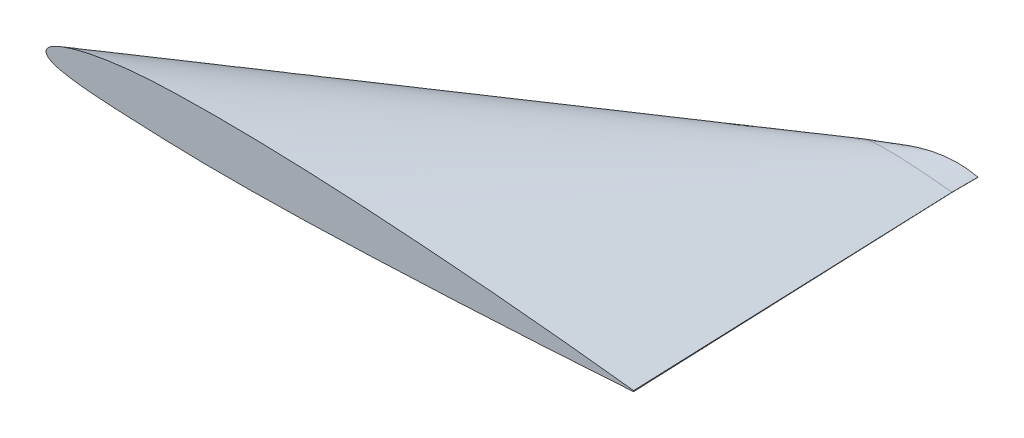
from build123d import *

# Parameters (mm, degrees)
ENL_V_MAT_EXTRU_1_DEPTH      = 6537.595381791
ENL_V_MAT_EXTRU_1_DEPTH_BACK = 6537.595381791
ESQUISSE15_W                 = 150
ESQUISSE15_H                 = 60
ENL_V_MAT_EXTRU_2_DEPTH      = 200


with BuildPart() as part:
    # Esquisse4 → Lissage2 section 0
    with BuildSketch(Plane.XY.offset(3692)):
        with BuildLine():
            Line((1163.137487, 5.49948), (1162.862513, -5.49948))
            add(Edge.make_bspline(
                [(1163.137487, 5.49948), (1159.78106179, 5.89669381), (1146.377392091, 7.482941789), (1116.297833912, 11.039513369), (1066.368733676, 16.900425245), (996.895597623, 24.963474912), (908.298083843, 35.080484665), (801.118937573, 47.101459337), (676.01009383, 60.834401529), (533.736979055, 76.062927652), (375.167522141, 92.556247028), (201.273798033, 110.089901214), (13.120890751, 128.423622932), (-188.135699779, 147.297255115), (-401.262664582, 166.464478241), (-624.949204201, 185.691297569), (-857.822130249, 204.706218302), (-1098.446242625, 223.266314764), (-1345.341449909, 241.09149941), (-1596.987428004, 257.939858027), (-1851.831449746, 273.536215856), (-2108.299983915, 287.619425525), (-2364.80991271, 299.911578585), (-2619.776181926, 310.18463934), (-2871.622338494, 318.185814838), (-3118.78806458, 323.714366097), (-3359.742111465, 326.581871654), (-3592.994296128, 326.655535892), (-3817.096397659, 323.806053153), (-4031.614130657, 318.112548808), (-4235.351320938, 309.000952609), (-4426.727146878, 293.845099443), (-4603.43565084, 274.03248396), (-4764.100368398, 250.194189162), (-4907.721668542, 223.181517449), (-5033.437384748, 193.803106045), (-5140.556678001, 162.863012439), (-5228.523026224, 131.09581304), (-5297.199939068, 99.233565666), (-5346.367811477, 67.467297955), (-5377.758957488, 35.828703944), (-5388.176056434, -0.41686513), (-5370.844102186, -33.827420078), (-5334.216990612, -58.759198867), (-5280.568860654, -80.740993568), (-5208.422300925, -99.867381814), (-5118.127051242, -116.596136827), (-5010.026464029, -130.988054128), (-4884.808251899, -143.303271984), (-4743.228742952, -153.870532207), (-4586.150463994, -163.016678971), (-4414.506740871, -171.237292035), (-4229.054003313, -178.837304984), (-4029.818915697, -187.031891328), (-3817.732690903, -193.143429014), (-3594.196495685, -196.730525783), (-3361.529942842, -197.986403644), (-3121.158890336, -197.033393791), (-2874.556017894, -194.039497573), (-2623.237342525, -189.218487827), (-2368.743030101, -182.789690913), (-2112.635050915, -174.98330921), (-1856.48667863, -166.02267363), (-1601.874693554, -156.146513558), (-1350.368962495, -145.542159056), (-1103.517808322, -134.431069727), (-862.84485688, -122.988356567), (-629.831484637, -111.388460878), (-405.920857852, -99.774144504), (-192.495844993, -88.302550494), (9.120441117, -77.098622961), (197.679630167, -66.292203212), (372.014797091, -56.02009427), (531.042213688, -46.387339906), (673.779461703, -37.541439679), (799.33410695, -29.569386976), (906.926140198, -22.603093993), (995.886416419, -16.756848485), (1065.658093761, -12.084283131), (1115.810295543, -8.708032179), (1146.025671734, -6.643152475), (1159.490800158, -5.728509609), (1162.862513, -5.49948)],
                knots=[0, 0, 0, 0, 0.000766498, 0.00306096, 0.006869104, 0.0121674, 0.018922159, 0.027092231, 0.03662638, 0.047465327, 0.059541866, 0.072781463, 0.087101665, 0.102414081, 0.118623542, 0.135630561, 0.153329686, 0.171611168, 0.190362332, 0.209467255, 0.228808125, 0.248264858, 0.267717609, 0.287046909, 0.306133614, 0.324860534, 0.343113432, 0.360781084, 0.37775727, 0.393938802, 0.409446397, 0.424002015, 0.437467007, 0.449764836, 0.460828766, 0.470599898, 0.479033183, 0.486099467, 0.49179537, 0.496160143, 0.499334803, 0.501730265, 0.504125152, 0.507288922, 0.511617008, 0.51723797, 0.524181213, 0.53243427, 0.541961526, 0.552712589, 0.564629489, 0.577643893, 0.591682903, 0.606722644, 0.622865238, 0.639799245, 0.657422637, 0.675630373, 0.694311464, 0.713351997, 0.732635699, 0.752045003, 0.771460131, 0.790761615, 0.809830421, 0.828548383, 0.84680031, 0.864472982, 0.881457663, 0.89764806, 0.912944362, 0.927251684, 0.940480559, 0.952549474, 0.963382766, 0.972913283, 0.981080683, 0.987834087, 0.993131631, 0.996939277, 0.999233585, 1, 1, 1, 1], degree=3))
        make_face()
    # Esquisse1 → Lissage2 section 1
    with BuildSketch(Plane.XY):
        with BuildLine():
            Line((1018.021378, 0.85512), (1017.978622, -0.85512))
            add(Edge.make_bspline(
                [(1018.021378, 0.85512), (1015.937227129, 1.101767387), (1011.26018293, 1.65527646), (1002.974701525, 2.627865114), (992.172249638, 3.88159729), (978.396127899, 5.454701908), (961.730728341, 7.323856057), (942.277421035, 9.459205859), (920.155222954, 11.827105598), (895.499089284, 14.391669387), (868.460168993, 17.117995942), (839.20407313, 19.968725851), (807.910471609, 22.903407012), (774.771132955, 25.883738941), (739.989874771, 28.873337548), (703.780215581, 31.829987816), (666.365316177, 34.715916974), (627.975317549, 37.487573912), (588.84661651, 40.10734313), (549.22064826, 42.532437413), (509.342082843, 44.722250677), (469.457080932, 46.633570643), (429.812104292, 48.230939797), (390.652277289, 49.475051093), (352.220215405, 50.334691414), (314.754014133, 50.780562906), (278.485383617, 50.792017037), (243.639509269, 50.348947932), (210.283918587, 49.46365888), (178.60460597, 48.046887087), (148.847375054, 45.690287343), (121.370781647, 42.609602669), (96.388853669, 38.902960832), (74.057024809, 34.702731749), (54.509354258, 30.134651284), (37.85326131, 25.32374319), (24.175280175, 20.384227535), (13.496633883, 15.42993277), (5.851469057, 10.490561985), (0.970426344, 5.57104332), (-0.649339461, -0.064818803), (2.045624557, -5.259861561), (7.740813129, -9.136530388), (16.082617971, -12.554503048), (27.300763351, -15.528485518), (41.340867853, -18.129657445), (58.149543244, -20.367471988), (77.619856357, -22.282378323), (99.63420493, -23.925492865), (124.058473752, -25.347636962), (150.747538994, -26.625868839), (179.583782592, -27.807602944), (210.563058473, -29.081787899), (243.540571355, -30.0320774), (278.298452328, -30.589838895), (314.476022329, -30.785116681), (351.851573184, -30.636932164), (390.196116356, -30.171408054), (429.273924746, -29.421784116), (468.845516322, -28.42216364), (508.66801866, -27.208341038), (548.496801765, -25.815042272), (588.086690387, -24.279387628), (627.193584265, -22.630505257), (665.576733027, -20.902830148), (702.99922647, -19.123590497), (739.230723788, -17.319910367), (774.046825524, -15.51398795), (807.232507988, -13.730257584), (838.582038958, -11.988146964), (867.901308005, -10.307845253), (895.008868709, -8.710624098), (919.736211018, -7.212816866), (941.930577671, -5.837358423), (961.453203127, -4.597775461), (978.182802921, -3.514579148), (992.015330978, -2.60554021), (1002.864203368, -1.878998049), (1010.662422615, -1.354021194), (1015.360643627, -1.032950851), (1017.454350781, -0.890732058), (1017.978622, -0.85512)],
                knots=[0, 0, 0, 0, 0.00306096, 0.006869104, 0.0121674, 0.018922159, 0.027092231, 0.03662638, 0.047465327, 0.059541866, 0.072781463, 0.087101665, 0.102414081, 0.118623542, 0.135630561, 0.153329686, 0.171611168, 0.190362332, 0.209467255, 0.228808125, 0.248264858, 0.267717609, 0.287046909, 0.306133614, 0.324860534, 0.343113432, 0.360781084, 0.37775727, 0.393938802, 0.409446397, 0.424002015, 0.437467007, 0.449764836, 0.460828766, 0.470599898, 0.479033183, 0.486099467, 0.49179537, 0.496160143, 0.499334803, 0.501730265, 0.504125152, 0.507288922, 0.511617008, 0.51723797, 0.524181213, 0.53243427, 0.541961526, 0.552712589, 0.564629489, 0.577643893, 0.591682903, 0.606722644, 0.622865238, 0.639799245, 0.657422637, 0.675630373, 0.694311464, 0.713351997, 0.732635699, 0.752045003, 0.771460131, 0.790761615, 0.809830421, 0.828548383, 0.84680031, 0.864472982, 0.881457663, 0.89764806, 0.912944362, 0.927251684, 0.940480559, 0.952549474, 0.963382766, 0.972913283, 0.981080683, 0.987834087, 0.993131631, 0.996939277, 0.999233585, 1, 1, 1, 1], degree=3))
        make_face()
    loft()

    # Esquisse11 → Lissage11 section 0
    with BuildSketch(Plane.XY.offset(-291)):
        with BuildLine():
            Line((1017.010689, 0.85512), (1016.989311, -0.85512))
            add(Edge.make_bspline(
                [(1017.010689, 0.85512), (1015.968662516, 1.101755795), (1013.630604319, 1.655155375), (1009.488376074, 2.627625328), (1004.087955119, 3.881175314), (997.200571264, 5.454133958), (988.868759257, 7.323101594), (979.143076644, 9.458258196), (968.082904989, 11.825987549), (955.755578331, 14.390432807), (942.236879706, 17.116647531), (927.60963915, 19.967270956), (911.963435532, 22.90190022), (895.394216264, 25.882216485), (878.004207088, 28.871782656), (859.899786119, 31.828449595), (841.192852995, 34.714392931), (821.998087264, 37.486121268), (802.43401032, 40.105969512), (782.621088579, 42.531185388), (762.68167066, 44.721156427), (742.73854362, 46.632688106), (722.915091383, 48.230290079), (703.333553865, 49.474654577), (684.115222533, 50.334527338), (665.37897119, 50.780552268), (647.2405725, 50.792033121), (629.812454434, 50.348649042), (613.125313637, 49.462805576), (597.256447413, 48.041695396), (582.357488419, 45.67795846), (568.599500226, 42.587731484), (556.089600456, 38.868339915), (544.904056721, 34.651084403), (535.107470588, 30.059595707), (526.752993856, 25.212719858), (519.87733351, 20.219896154), (514.506176065, 15.16615512), (510.655834279, 10.107638519), (508.356833584, 5.052560994), (507.720487238, 0.068104938), (508.770552543, -4.653362254), (511.538202456, -8.83906199), (515.815554065, -12.407683731), (521.504991894, -15.471089386), (528.583485385, -18.102795627), (537.021858751, -20.356284072), (546.778531224, -22.277136393), (557.798267312, -23.923143079), (570.018536684, -25.346540086), (583.367795314, -26.625366601), (597.790019797, -27.807435203), (613.272321516, -29.081108562), (629.763200366, -30.031796186), (647.146154658, -30.589790593), (665.237821585, -30.785126651), (683.927663124, -30.636907135), (703.101273778, -30.171309222), (722.640954757, -29.421606767), (742.42709724, -28.421921021), (762.338401497, -27.20805222), (782.252597675, -25.814731594), (802.047341545, -24.279063112), (821.600405021, -22.630189366), (840.791675672, -20.902523291), (859.502615479, -19.123297913), (877.618152719, -17.319626376), (895.025938853, -15.513720922), (911.61863058, -13.729997746), (927.293218871, -11.987898489), (941.95263131, -10.307615454), (955.50628793, -8.710402418), (967.869637035, -7.212629137), (978.966716865, -5.837179229), (988.727675541, -4.597637376), (997.092161926, -3.514480077), (1004.00834299, -2.605450065), (1009.432347315, -1.878965098), (1013.331456705, -1.353987833), (1015.680289844, -1.032955193), (1016.727173594, -0.890732302), (1016.989311, -0.85512)],
                knots=[0, 0, 0, 0, 0.003056441, 0.006857926, 0.012144646, 0.0188807, 0.027022764, 0.036517114, 0.047301785, 0.059307024, 0.072456183, 0.086664852, 0.101842805, 0.117893617, 0.134717022, 0.152206846, 0.170253151, 0.188743266, 0.207561961, 0.226592427, 0.245716214, 0.264815804, 0.283775153, 0.302479486, 0.320817322, 0.33868149, 0.355969352, 0.372584786, 0.388436261, 0.403662019, 0.418037642, 0.431460549, 0.443882367, 0.455258974, 0.465550233, 0.474729126, 0.482787477, 0.489753082, 0.495707884, 0.500826465, 0.505424548, 0.509802757, 0.514334163, 0.519482974, 0.525550406, 0.532696692, 0.540992813, 0.550454929, 0.561065643, 0.572787818, 0.585567358, 0.599341163, 0.614091303, 0.629906599, 0.646483338, 0.663728724, 0.68154543, 0.699828842, 0.71847016, 0.737357156, 0.756375443, 0.775407788, 0.794336727, 0.813045038, 0.831415991, 0.849335791, 0.866692541, 0.883378819, 0.899289507, 0.914325965, 0.928394307, 0.941405881, 0.953279903, 0.963941076, 0.973322701, 0.981364397, 0.988015229, 0.993233377, 0.996984422, 0.999244906, 1, 1, 1, 1], degree=3))
        make_face()
    # Esquisse10 → Lissage11 section 1
    with BuildSketch(Plane.XY):
        with BuildLine():
            Line((1018.021378, 0.85512), (1017.978622, -0.85512))
            add(Edge.make_bspline(
                [(1018.021378, 0.85512), (1015.937227129, 1.101767387), (1011.26018293, 1.65527646), (1002.974701525, 2.627865114), (992.172249638, 3.88159729), (978.396127899, 5.454701908), (961.730728341, 7.323856057), (942.277421035, 9.459205859), (920.155222954, 11.827105598), (895.499089284, 14.391669387), (868.460168993, 17.117995942), (839.20407313, 19.968725851), (807.910471609, 22.903407012), (774.771132955, 25.883738941), (739.989874771, 28.873337548), (703.780215581, 31.829987816), (666.365316177, 34.715916974), (627.975317549, 37.487573912), (588.84661651, 40.10734313), (549.22064826, 42.532437413), (509.342082843, 44.722250677), (469.457080932, 46.633570643), (429.812104292, 48.230939797), (390.652277289, 49.475051093), (352.220215405, 50.334691414), (314.754014133, 50.780562906), (278.485383617, 50.792017037), (243.639509269, 50.348947932), (210.283918587, 49.46365888), (178.60460597, 48.046887087), (148.847375054, 45.690287343), (121.370781647, 42.609602669), (96.388853669, 38.902960832), (74.057024809, 34.702731749), (54.509354258, 30.134651284), (37.85326131, 25.32374319), (24.175280175, 20.384227535), (13.496633883, 15.42993277), (5.851469057, 10.490561985), (0.970426344, 5.57104332), (-0.649339461, -0.064818803), (2.045624557, -5.259861561), (7.740813129, -9.136530388), (16.082617971, -12.554503048), (27.300763351, -15.528485518), (41.340867853, -18.129657445), (58.149543244, -20.367471988), (77.619856357, -22.282378323), (99.63420493, -23.925492865), (124.058473752, -25.347636962), (150.747538994, -26.625868839), (179.583782592, -27.807602944), (210.563058473, -29.081787899), (243.540571355, -30.0320774), (278.298452328, -30.589838895), (314.476022329, -30.785116681), (351.851573184, -30.636932164), (390.196116356, -30.171408054), (429.273924746, -29.421784116), (468.845516322, -28.42216364), (508.66801866, -27.208341038), (548.496801765, -25.815042272), (588.086690387, -24.279387628), (627.193584265, -22.630505257), (665.576733027, -20.902830148), (702.99922647, -19.123590497), (739.230723788, -17.319910367), (774.046825524, -15.51398795), (807.232507988, -13.730257584), (838.582038958, -11.988146964), (867.901308005, -10.307845253), (895.008868709, -8.710624098), (919.736211018, -7.212816866), (941.930577671, -5.837358423), (961.453203127, -4.597775461), (978.182802921, -3.514579148), (992.015330978, -2.60554021), (1002.864203368, -1.878998049), (1010.662422615, -1.354021194), (1015.360643627, -1.032950851), (1017.454350781, -0.890732058), (1017.978622, -0.85512)],
                knots=[0, 0, 0, 0, 0.00306096, 0.006869104, 0.0121674, 0.018922159, 0.027092231, 0.03662638, 0.047465327, 0.059541866, 0.072781463, 0.087101665, 0.102414081, 0.118623542, 0.135630561, 0.153329686, 0.171611168, 0.190362332, 0.209467255, 0.228808125, 0.248264858, 0.267717609, 0.287046909, 0.306133614, 0.324860534, 0.343113432, 0.360781084, 0.37775727, 0.393938802, 0.409446397, 0.424002015, 0.437467007, 0.449764836, 0.460828766, 0.470599898, 0.479033183, 0.486099467, 0.49179537, 0.496160143, 0.499334803, 0.501730265, 0.504125152, 0.507288922, 0.511617008, 0.51723797, 0.524181213, 0.53243427, 0.541961526, 0.552712589, 0.564629489, 0.577643893, 0.591682903, 0.606722644, 0.622865238, 0.639799245, 0.657422637, 0.675630373, 0.694311464, 0.713351997, 0.732635699, 0.752045003, 0.771460131, 0.790761615, 0.809830421, 0.828548383, 0.84680031, 0.864472982, 0.881457663, 0.89764806, 0.912944362, 0.927251684, 0.940480559, 0.952549474, 0.963382766, 0.972913283, 0.981080683, 0.987834087, 0.993131631, 0.996939277, 0.999233585, 1, 1, 1, 1], degree=3))
        make_face()
    loft()

    # Esquisse14 → Enlèv. mat.-Extru.1 (cut, two sides: drawn at the far end of the back side and taken through both)
    with BuildSketch(Plane(origin=(0, 0, 0), x_dir=(1, 0, 0), z_dir=(0, 1, 0)).offset(-ENL_V_MAT_EXTRU_1_DEPTH_BACK)):
        with BuildLine():
            Line((508.5053445, 293.64677483), (84.590575027, 48.848551557))
            ThreePointArc((84.590575027, 48.848551557), (535.894069527, 227.322977218), (1017.010689, 291))
            Line((1017.010689, 291), (508.5053445, 293.64677483))
        make_face()
    extrude(amount=ENL_V_MAT_EXTRU_1_DEPTH + ENL_V_MAT_EXTRU_1_DEPTH_BACK, mode=Mode.SUBTRACT)

    # Esquisse15 → Enlèv. mat.-Extru.2 (cut)
    with BuildSketch(Plane(origin=(0, 0, 0), x_dir=(1, 0, 0), z_dir=(0, 1, 0))):
        with Locations((-1433.806004996, -3057)):
            Rectangle(ESQUISSE15_W, ESQUISSE15_H)
        with Locations((-1433.806004996, -2497)):
            Rectangle(ESQUISSE15_W, ESQUISSE15_H)
    extrude(amount=-ENL_V_MAT_EXTRU_2_DEPTH, mode=Mode.SUBTRACT)


solid = part.part
